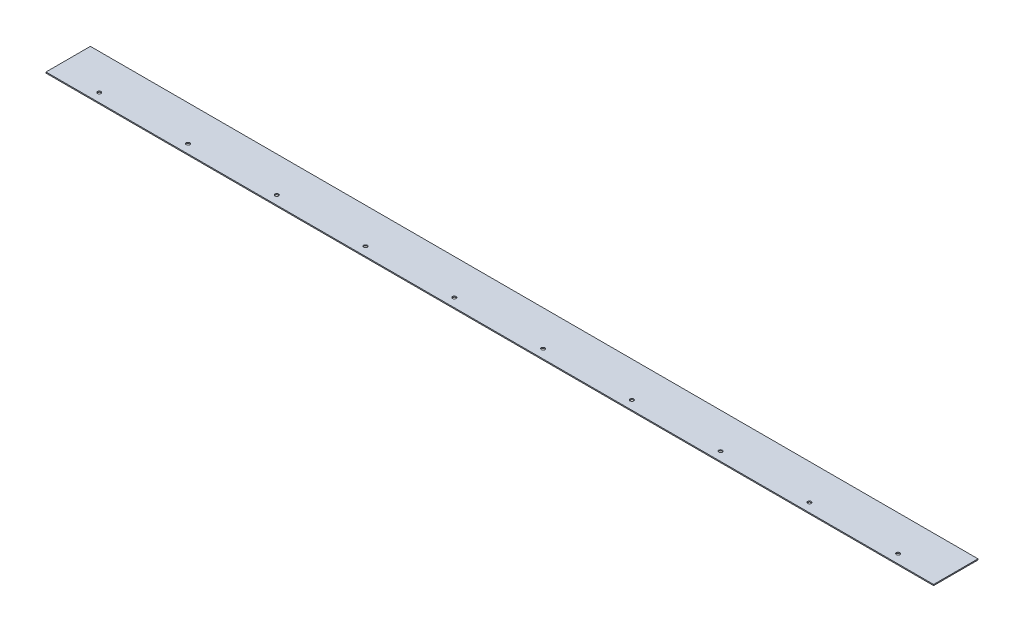
from build123d import *

# Parameters (mm, degrees)
SKETCH1_W          = 1000
SKETCH1_H          = 50
BASE_FLANGE1_DEPTH = 1.2
SKETCH2_R          = 2
CUT_EXTRUDE1_DEPTH = 10


# Sheet-metal steps are written as plain solids
with BuildPart() as part:
    # Sketch1 → Base-Flange1 (new body)
    with BuildSketch(Plane(origin=(0, 0, 0), x_dir=(1, 0, 0), z_dir=(0, 1, 0))):
        Rectangle(SKETCH1_W, SKETCH1_H)
    extrude(amount=-BASE_FLANGE1_DEPTH)

    # Sketch2 → Cut-Extrude1 (cut)
    with BuildSketch(Plane(origin=(0, 0, 0), x_dir=(1, 0, 0), z_dir=(0, 1, 0))):
        with Locations(Location((-450, -15, 0), (0, 0, 270))):
            Circle(SKETCH2_R)
        with Locations(Location((-350, -15, 0), (0, 0, 270))):
            Circle(SKETCH2_R)
        with Locations(Location((-250, -15, 0), (0, 0, 270))):
            Circle(SKETCH2_R)
        with Locations(Location((-150, -15, 0), (0, 0, 270))):
            Circle(SKETCH2_R)
        with Locations(Location((-50, -15, 0), (0, 0, 270))):
            Circle(SKETCH2_R)
        with Locations(Location((50, -15, 0), (0, 0, 270))):
            Circle(SKETCH2_R)
        with Locations(Location((150, -15, 0), (0, 0, 270))):
            Circle(SKETCH2_R)
        with Locations(Location((250, -15, 0), (0, 0, 270))):
            Circle(SKETCH2_R)
        with Locations(Location((350, -15, 0), (0, 0, 270))):
            Circle(SKETCH2_R)
        with Locations(Location((450, -15, 0), (0, 0, 270))):
            Circle(SKETCH2_R)
    extrude(amount=-CUT_EXTRUDE1_DEPTH, mode=Mode.SUBTRACT)


solid = part.part
